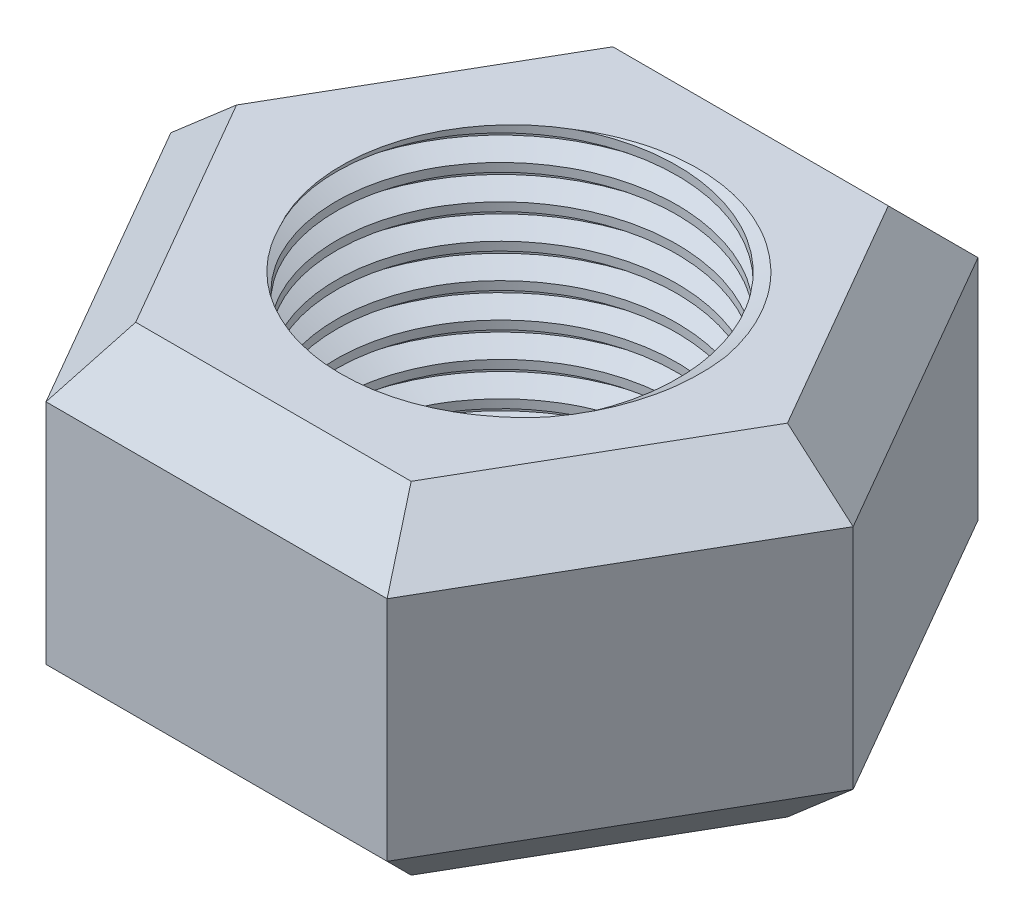
from build123d import *

# Parameters (mm, degrees)
SKETCH1_R           = 1.5
BOSS_EXTRUDE1_DEPTH = 3
CHAMFER1_SIZE       = 0.5
THREAD1_PITCH       = 0.3


with BuildPart() as part:
    # Sketch1 → Boss-Extrude1 (new body)
    with BuildSketch(Plane(origin=(0, 0, 0), x_dir=(1, 0, 0), z_dir=(0, 1, 0))):
        Polygon((1.5, 2.598076211), (-1.5, 2.598076211), (-3, 0), (-1.5, -2.598076211), (1.5, -2.598076211), (3, 0), align=None)
        with Locations(Location((0, 0, 0), (0, 0, 270))):
            Circle(SKETCH1_R, mode=Mode.SUBTRACT)
    extrude(amount=BOSS_EXTRUDE1_DEPTH)

    # Chamfer1
    chamfer1_edges = [part.edges().sort_by_distance(p)[0] for p in [
        (-2.25, 3, -1.299038106),
        (-2.25, 3, 1.299038106),
        (0, 3, 2.598076211),
        (2.25, 3, 1.299038106),
        (2.25, 3, -1.299038106),
        (2.25, 0, 1.299038106),
        (0, 0, 2.598076211),
        (-2.25, 0, 1.299038106),
        (-2.25, 0, -1.299038106),
        (0, 0, -2.598076211),
        (2.25, 0, -1.299038106),
        (0, 3, -2.598076211),
    ]]
    chamfer(chamfer1_edges, length=CHAMFER1_SIZE)

    # Thread1: the profile of Thread Profile1 profile screwed along a right-hand helix of 13.333333 turns, 6 arcs to a turn; built about Z, then put on its axis
    thread1_z = Axis((0, 0, 0), (0, 0, 1))
    thread1_corners = [(1.4997, 0, -0.000173205), (1.662379763, 0, 0.09375), (1.662379763, 0, 0.13125), (1.4997, 0, 0.225173204)]
    with BuildLine(mode=Mode.PRIVATE) as thread1_profile:
        Line(thread1_corners[0], thread1_corners[1])
        Line(thread1_corners[1], thread1_corners[2])
        Line(thread1_corners[2], thread1_corners[3])
        Line(thread1_corners[3], thread1_corners[0])
    thread1_cap = Face(thread1_profile.wire())
    thread1_turn_angles = [0, 30, 60, 90, 120, 150, 180, 210, 240, 270, 300, 330, 360]
    thread1_turn_weights = [1, 0.8660254037844387, 1, 0.8660254037844387, 1, 0.8660254037844387, 1, 0.8660254037844387, 1, 0.8660254037844387, 1, 0.8660254037844387, 1]
    thread1_turn_rails = [Edge.make_bspline([Vector(p[0], p[1], 0).rotate(thread1_z, thread1_turn_angles[k]) / thread1_turn_weights[k] + Vector(0, 0, p[2] + THREAD1_PITCH * thread1_turn_angles[k] / 360) for k in range(13)], [0, 0, 0, 1, 1, 2, 2, 3, 3, 4, 4, 5, 5, 6, 6, 6], 2, thread1_turn_weights) for p in thread1_corners]
    thread1_turn_sides = [Face.make_surface_from_curves(thread1_turn_rails[p[0]], thread1_turn_rails[p[1]]) for p in [(0, 1), (1, 2), (2, 3), (3, 0)]]
    thread1_last_angles = [4680, 4710, 4740, 4770, 4800]
    thread1_last_weights = [1, 0.8660254037844387, 1, 0.8660254037844387, 1]
    thread1_last_rails = [Edge.make_bspline([Vector(p[0], p[1], 0).rotate(thread1_z, thread1_last_angles[k]) / thread1_last_weights[k] + Vector(0, 0, p[2] + THREAD1_PITCH * thread1_last_angles[k] / 360) for k in range(5)], [0, 0, 0, 1, 1, 2, 2, 2], 2, thread1_last_weights) for p in thread1_corners]
    thread1_last_sides = [Face.make_surface_from_curves(thread1_last_rails[p[0]], thread1_last_rails[p[1]]) for p in [(0, 1), (1, 2), (2, 3), (3, 0)]]
    thread1 = Plane(origin=(0, -1, 0), x_dir=(1, 0, 0), z_dir=(0, 1, 0)) * Solid(Shell([*[p.moved(Location((0, 0, THREAD1_PITCH * i))) for i in range(13) for p in thread1_turn_sides], *thread1_last_sides, thread1_cap, thread1_cap.rotate(thread1_z, 4800).moved(Location((0, 0, THREAD1_PITCH * 4800 / 360)))]))
    add(thread1, mode=Mode.SUBTRACT)


solid = part.part
